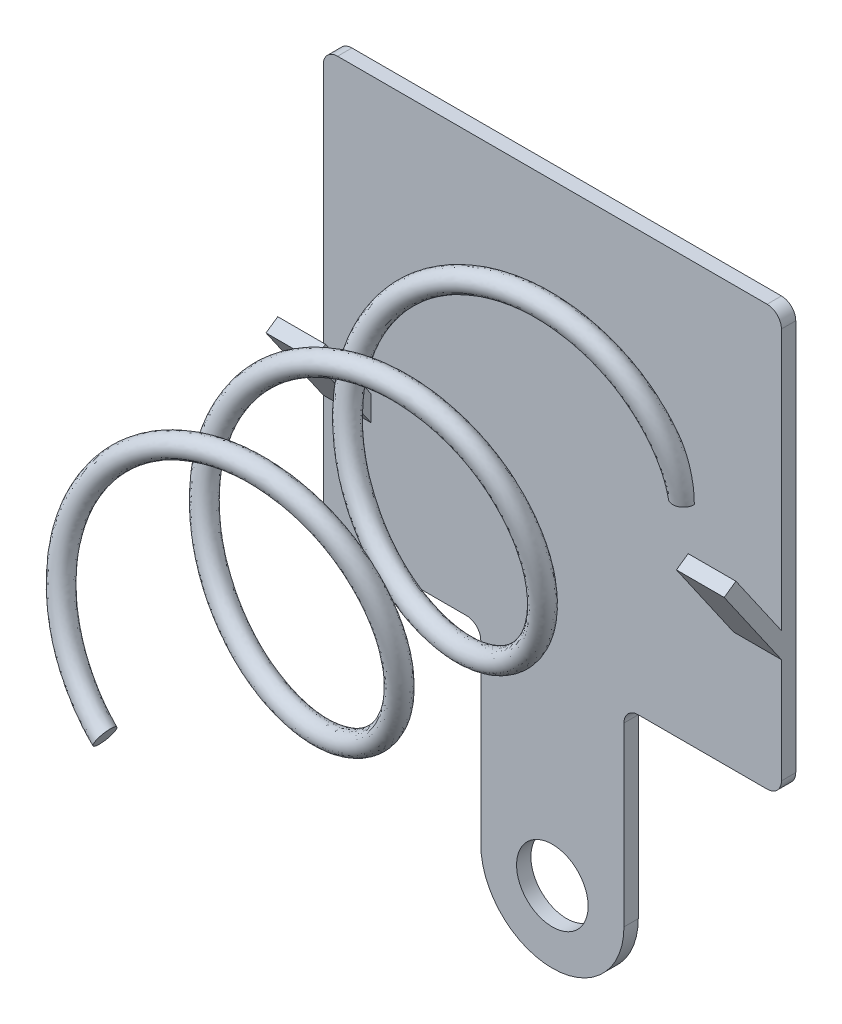
from build123d import *

# Parameters (mm, degrees)
SKETCH1_R           = 0.75
BOSS_EXTRUDE1_DEPTH = 0.3
FILLET1_R           = 0.3
BOSS_EXTRUDE2_DEPTH = 1
SWEEP1_PITCH        = 3


with BuildPart() as part:
    # Sketch1 → Boss-Extrude1 (new body)
    with BuildSketch(Plane.XY):
        with BuildLine():
            Line((-4.8, 4.4), (4.8, 4.4))
            Line((4.8, 4.4), (4.8, -4.4))
            Line((4.8, -4.4), (1.5, -4.4))
            Line((1.5, -4.4), (1.5, -8.4))
            ThreePointArc((1.5, -8.4), (0, -9.9), (-1.5, -8.4))
            Line((-1.5, -8.4), (-1.5, -4.4))
            Line((-1.5, -4.4), (-4.8, -4.4))
            Line((-4.8, -4.4), (-4.8, 4.4))
        make_face()
        with Locations((0, -8.4)):
            Circle(SKETCH1_R, mode=Mode.SUBTRACT)
    extrude(amount=BOSS_EXTRUDE1_DEPTH)

    # Fillet1
    fillet1_edges = [part.edges().sort_by_distance(p)[0] for p in [
        (-4.8, -4.4, 0.15),
        (-4.8, 4.4, 0.15),
        (4.8, 4.4, 0.15),
        (4.8, -4.4, 0.15),
        (1.5, -4.4, 0.15),
        (-1.5, -4.4, 0.15),
    ]]
    fillet(fillet1_edges, radius=FILLET1_R)

    # Sketch2 → Boss-Extrude2 (add)
    with BuildSketch(Plane(origin=(4.8, 0, 0), x_dir=(0, 0, -1), z_dir=(1, 0, 0))):
        Polygon((-0.3, -1.9), (-1.5, -0.171055671), (-1.253545223, 0), (-0.3, -1.373855504), align=None)
    boss_extrude2 = extrude(amount=-BOSS_EXTRUDE2_DEPTH)

    # Mirror1: Boss-Extrude2 across plane
    add(boss_extrude2.mirror(Plane(origin=(0, 0, 0), x_dir=(0, 0, 1), z_dir=(1, 0, 0))))

    # Sweep1: the profile of Sketch4 screwed along a right-hand helix of 2.666667 turns, 10 arcs to a turn; built about Z, then put on its axis
    sweep1_z = Axis((0, 0, 0), (0, 0, 1))
    sweep1_corners = [(2.975, 0, 0), (2.75, 0, -0.225), (2.525, 0, 0), (2.75, 0, 0.225)]
    with BuildLine(mode=Mode.PRIVATE) as sweep1_profile:
        ThreePointArc((2.975, 0, 0), (2.909099026, 0, -0.159099026), (2.75, 0, -0.225))
        ThreePointArc((2.75, 0, -0.225), (2.590900974, 0, -0.159099026), (2.525, 0, 0))
        ThreePointArc((2.525, 0, 0), (2.590900974, 0, 0.159099026), (2.75, 0, 0.225))
        ThreePointArc((2.75, 0, 0.225), (2.909099026, 0, 0.159099026), (2.975, 0, 0))
    sweep1_cap = Face(sweep1_profile.wire())
    sweep1_arcs = [((2.975, 0, 0), (2.975, 0, -0.225), (2.75, 0, -0.225), (1, 0.7071067811865475, 1)), ((2.75, 0, -0.225), (2.525, 0, -0.225), (2.525, 0, 0), (1, 0.7071067811865475, 1)), ((2.525, 0, 0), (2.525, 0, 0.225), (2.75, 0, 0.225), (1, 0.7071067811865475, 1)), ((2.75, 0, 0.225), (2.975, 0, 0.225), (2.975, 0, 0), (1, 0.7071067811865475, 1))]  # start, shoulder, end, weights
    sweep1_turn_angles = [0, 18, 36, 54, 72, 90, 108, 126, 144, 162, 180, 198, 216, 234, 252, 270, 288, 306, 324, 342, 360]
    sweep1_turn_weights = [1, 0.9510565162951535, 1, 0.9510565162951535, 1, 0.9510565162951535, 1, 0.9510565162951535, 1, 0.9510565162951535, 1, 0.9510565162951535, 1, 0.9510565162951535, 1, 0.9510565162951535, 1, 0.9510565162951535, 1, 0.9510565162951535, 1]
    sweep1_turn_sides = [Face.make_bezier_surface([[Vector(p[j][0], p[j][1], 0).rotate(sweep1_z, sweep1_turn_angles[2 * i + k]) / sweep1_turn_weights[2 * i + k] + Vector(0, 0, p[j][2] + SWEEP1_PITCH * sweep1_turn_angles[2 * i + k] / 360) for k in range(3)] for j in range(3)], [[p[3][j] * sweep1_turn_weights[2 * i + k] for k in range(3)] for j in range(3)]) for p in sweep1_arcs for i in range(10)]
    sweep1_last_angles = [720, 738, 756, 774, 792, 810, 828, 846, 864, 882, 900, 918, 936, 948, 960]
    sweep1_last_weights = [1, 0.9510565162951535, 1, 0.9510565162951535, 1, 0.9510565162951535, 1, 0.9510565162951535, 1, 0.9510565162951535, 1, 0.9510565162951535, 1, 0.9781476007338026, 1]
    sweep1_last_sides = [Face.make_bezier_surface([[Vector(p[j][0], p[j][1], 0).rotate(sweep1_z, sweep1_last_angles[2 * i + k]) / sweep1_last_weights[2 * i + k] + Vector(0, 0, p[j][2] + SWEEP1_PITCH * sweep1_last_angles[2 * i + k] / 360) for k in range(3)] for j in range(3)], [[p[3][j] * sweep1_last_weights[2 * i + k] for k in range(3)] for j in range(3)]) for p in sweep1_arcs for i in range(7)]
    sweep1 = Plane(origin=(0, 0, 0.3), x_dir=(1, 0, 0), z_dir=(0, 0, 1)) * Solid(Shell([*[p.moved(Location((0, 0, SWEEP1_PITCH * i))) for i in range(2) for p in sweep1_turn_sides], *sweep1_last_sides, sweep1_cap, sweep1_cap.rotate(sweep1_z, 960).moved(Location((0, 0, SWEEP1_PITCH * 960 / 360)))]))
    add(sweep1)


solid = part.part
